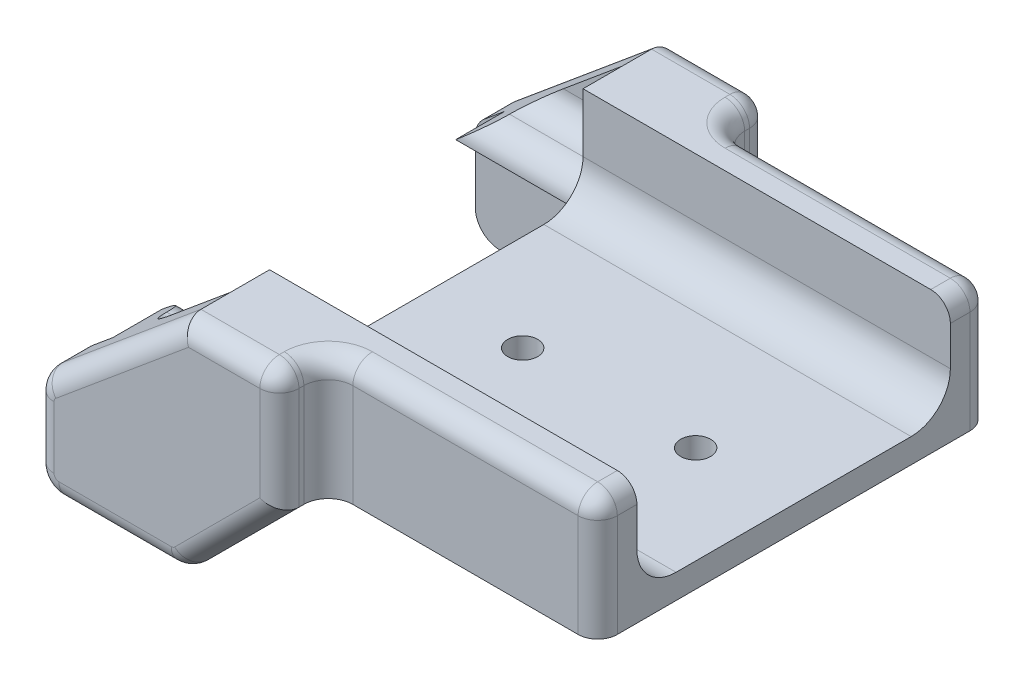
from build123d import *

# Parameters (mm, degrees)
SKETCH1_W           = 47.625
SKETCH1_H           = 50.8
BOSS_EXTRUDE1_DEPTH = 3.175
SKETCH2_R           = 1.9431
CUT_EXTRUDE1_DEPTH  = 35.961060929
SKETCH3_W           = 5.08
SKETCH3_H           = 12.7
BOSS_EXTRUDE2_DEPTH = 47.625
FILLET1_R           = 5.08
BOSS_EXTRUDE4_DEPTH = 6.35
FILLET4_R           = 3.175
BOSS_EXTRUDE5_DEPTH = 6.35
FILLET6_R           = 3.175
BOSS_EXTRUDE6_DEPTH = 6.35
FILLET8_R           = 3.175
FILLET9_R           = 3.175
FILLET10_R          = 2.54
FILLET11_R          = 2.54
FILLET12_R          = 2.54


with BuildPart() as part:
    # Sketch1 → Boss-Extrude1 (new body)
    with BuildSketch(Plane(origin=(0, 0, 0), x_dir=(1, 0, 0), z_dir=(0, 1, 0))):
        Rectangle(SKETCH1_W, SKETCH1_H)
    extrude(amount=BOSS_EXTRUDE1_DEPTH)

    # Sketch2 → Cut-Extrude1 (cut, through all)
    with BuildSketch(Plane(origin=(0, 3.175, 0), x_dir=(1, 0, 0), z_dir=(0, 1, 0))):
        with Locations(Location((11.1125, 0, 0), (0, 0, 270))):
            Circle(SKETCH2_R)
        with Locations(Location((-11.3157, 0, 0), (0, 0, 270))):
            Circle(SKETCH2_R)
    extrude(amount=-CUT_EXTRUDE1_DEPTH, mode=Mode.SUBTRACT)

    # Sketch3 → Boss-Extrude2 (add)
    with BuildSketch(Plane(origin=(23.8125, 0, 0), x_dir=(0, 0, -1), z_dir=(1, 0, 0))):
        with Locations((-22.86, 9.525)):
            Rectangle(SKETCH3_W, SKETCH3_H)
        with Locations((22.86, 9.525)):
            Rectangle(SKETCH3_W, SKETCH3_H)
    extrude(amount=-BOSS_EXTRUDE2_DEPTH)

    # Fillet1
    fillet1_edges = [part.edges().sort_by_distance(p)[0] for p in [
        (0, 3.175, 20.32),
        (0, 3.175, -20.32),
    ]]
    fillet(fillet1_edges, radius=FILLET1_R)

    # Sketch5 → Boss-Extrude4 (add)
    with BuildSketch(Plane(origin=(0, 0, -25.4), x_dir=(-1, 0, 0), z_dir=(0, 0, -1))):
        Polygon((11.1125, 15.875), (23.8125, 15.875), (42.8625, 0), (42.8625, -12.7), (23.8125, -12.7), (11.1125, 0), align=None)
    extrude(amount=BOSS_EXTRUDE4_DEPTH)

    # Fillet4
    # the kernel refuses this fillet: 3.175 mm, written as the material it adds along each edge
    with BuildSketch(Plane(origin=(-11.1125, 0, -25.4), x_dir=(1, 0, 0), z_dir=(0, 1, 0))) as fillet4_piece_1:
        with BuildLine():
            CenterArc((FILLET4_R, FILLET4_R), FILLET4_R, 180, 90)
            Line((0, FILLET4_R), (0, 0))
            Line((0, 0), (FILLET4_R, 0))
        make_face()
    extrude(amount=15.875)
    # the kernel refuses this fillet: 3.175 mm, written as the material it takes off along each edge
    with BuildSketch(Plane(origin=(-23.8125, -12.7, -22.112179849), x_dir=(0.7071067811865468, 0.7071067811865482, 0), z_dir=(0, 0, -1))) as fillet4_2_piece_1:
        with BuildLine():
            CenterArc((FILLET4_R * 0.414213562373, -FILLET4_R), FILLET4_R, 90, 45)
            Line((-FILLET4_R * 0.292893218813, -FILLET4_R * 0.292893218813), (0, 0))
            Line((0, 0), (FILLET4_R * 0.414213562373, 0))
        make_face()
    extrude(amount=12.925640303, mode=Mode.SUBTRACT)
    with BuildSketch(Plane(origin=(-42.8625, -12.7, -17.4625), x_dir=(1, 0, 0), z_dir=(0, 0, -1))) as fillet4_2_piece_2:
        with BuildLine():
            CenterArc((FILLET4_R, -FILLET4_R), FILLET4_R, 90, 90)
            Line((0, -FILLET4_R), (0, 0))
            Line((0, 0), (FILLET4_R, 0))
        make_face()
    extrude(amount=22.225, mode=Mode.SUBTRACT)
    with BuildSketch(Plane(origin=(-42.8625, 0, -21.682273866), x_dir=(0.7682212795973764, 0.6401843996644792, 0), z_dir=(0, 0, -1))) as fillet4_2_piece_3:
        with BuildLine():
            CenterArc((FILLET4_R * 0.468374945984, FILLET4_R), FILLET4_R, 219.805571092, 50.194428908)
            Line((-FILLET4_R * 0.299846333613, FILLET4_R * 0.359815600336), (0, 0))
            Line((0, 0), (FILLET4_R * 0.468374945984, 0))
        make_face()
    extrude(amount=13.785452268, mode=Mode.SUBTRACT)

    # Sketch6 → Boss-Extrude5 (add)
    with BuildSketch(Plane.XY.offset(25.4)):
        Polygon((-11.1125, 15.875), (-23.8125, 15.875), (-42.8625, 0), (-42.8625, -12.7), (-23.8125, -12.7), (-11.1125, 0), align=None)
    extrude(amount=BOSS_EXTRUDE5_DEPTH)

    # Fillet6
    # the kernel refuses this fillet: 3.175 mm, written as the material it adds along each edge
    with BuildSketch(Plane(origin=(-11.1125, 0, 25.4), x_dir=(1, 0, 0), z_dir=(0, 1, 0))) as fillet6_piece_1:
        with BuildLine():
            CenterArc((FILLET6_R, -FILLET6_R), FILLET6_R, 90, 90)
            Line((0, -FILLET6_R), (0, 0))
            Line((0, 0), (FILLET6_R, 0))
        make_face()
    extrude(amount=15.875)
    # the kernel refuses this fillet: 3.175 mm, written as the material it takes off along each edge
    with BuildSketch(Plane(origin=(-42.8625, 0, 21.682273866), x_dir=(0, -1, 0), z_dir=(0, 0, 1))) as fillet6_2_piece_1:
        with BuildLine():
            CenterArc((FILLET6_R * 0.468374945984, FILLET6_R), FILLET6_R, 219.805571092, 50.194428908)
            Line((-FILLET6_R * 0.299846333613, FILLET6_R * 0.359815600336), (0, 0))
            Line((0, 0), (FILLET6_R * 0.468374945984, 0))
        make_face()
    extrude(amount=13.785452268, mode=Mode.SUBTRACT)
    with BuildSketch(Plane(origin=(-42.8625, -12.7, 17.4625), x_dir=(1, 0, 0), z_dir=(0, 0, 1))) as fillet6_2_piece_2:
        with BuildLine():
            CenterArc((FILLET6_R, FILLET6_R), FILLET6_R, 180, 90)
            Line((0, FILLET6_R), (0, 0))
            Line((0, 0), (FILLET6_R, 0))
        make_face()
    extrude(amount=22.225, mode=Mode.SUBTRACT)
    with BuildSketch(Plane(origin=(-23.8125, -12.7, 22.112179849), x_dir=(0.7071067811865468, 0.7071067811865482, 0), z_dir=(0, 0, 1))) as fillet6_2_piece_3:
        with BuildLine():
            CenterArc((FILLET6_R * 0.414213562373, FILLET6_R), FILLET6_R, 225, 45)
            Line((-FILLET6_R * 0.292893218813, FILLET6_R * 0.292893218813), (0, 0))
            Line((0, 0), (FILLET6_R * 0.414213562373, 0))
        make_face()
    extrude(amount=12.925640303, mode=Mode.SUBTRACT)

    # Sketch7 → Boss-Extrude6 (add)
    with BuildSketch(Plane.XY.offset(-25.4)):
        Polygon((-23.8125, 3.175), (-39.0525, 3.175), (-35.2425, 6.35), (-23.8125, 6.35), align=None)
    boss_extrude6 = extrude(amount=BOSS_EXTRUDE6_DEPTH)

    # Fillet8
    # the kernel refuses this fillet: 3.175 mm, written as the material it adds along each edge
    with BuildSketch(Plane(origin=(-43.18, 6.35, -25.4), x_dir=(0, 0, 1), z_dir=(1, 0, 0))) as fillet8_piece_1_section:
        with BuildLine():
            CenterArc((FILLET8_R, -FILLET8_R), FILLET8_R, 90, 90)
            Line((0, -FILLET8_R), (0, 0))
            Line((0, 0), (FILLET8_R, 0))
        make_face()
    fillet8_piece_1 = extrude(amount=27.305, mode=Mode.PRIVATE)
    fillet8_piece_1 = split(fillet8_piece_1, bisect_by=Plane(origin=(-31.306679487, 9.629850427, -24.649765277), z_dir=(0.6401843996644798, -0.768221279597376, 0)), keep=Keep.TOP, mode=Mode.PRIVATE)
    add(fillet8_piece_1)
    # the kernel refuses this fillet: 3.175 mm, written as the material it takes off along each edge
    with BuildSketch(Plane(origin=(-43.18, 6.35, -19.05), x_dir=(0, -1, 0), z_dir=(1, 0, 0))) as fillet8_2_piece_1:
        with BuildLine():
            CenterArc((FILLET8_R, FILLET8_R), FILLET8_R, 180, 90)
            Line((0, FILLET8_R), (0, 0))
            Line((0, 0), (FILLET8_R, 0))
        make_face()
    extrude(amount=19.3675, mode=Mode.SUBTRACT)

    # Mirror5: Boss-Extrude6 across plane
    add(boss_extrude6.mirror(Plane.XY))

    # Fillet9
    # the kernel refuses this fillet: 3.175 mm, written as the material it adds along each edge
    with BuildSketch(Plane(origin=(-43.18, 6.35, 25.4), x_dir=(0, 0, -1), z_dir=(1, 0, 0))) as fillet9_piece_1_section:
        with BuildLine():
            CenterArc((FILLET9_R, FILLET9_R), FILLET9_R, 180, 90)
            Line((0, FILLET9_R), (0, 0))
            Line((0, 0), (FILLET9_R, 0))
        make_face()
    fillet9_piece_1 = extrude(amount=27.305, mode=Mode.PRIVATE)
    fillet9_piece_1 = split(fillet9_piece_1, bisect_by=Plane(origin=(-31.306679487, 9.629850427, 24.649765277), z_dir=(0.6401843996644802, -0.7682212795973757, 0)), keep=Keep.TOP, mode=Mode.PRIVATE)
    add(fillet9_piece_1)
    # the kernel refuses this fillet: 3.175 mm, written as the material it takes off along each edge
    with BuildSketch(Plane(origin=(-43.18, 6.35, 19.05), x_dir=(0, -1, 0), z_dir=(1, 0, 0))) as fillet9_2_piece_1:
        with BuildLine():
            CenterArc((FILLET9_R, -FILLET9_R), FILLET9_R, 90, 90)
            Line((0, -FILLET9_R), (0, 0))
            Line((0, 0), (FILLET9_R, 0))
        make_face()
    extrude(amount=19.3675, mode=Mode.SUBTRACT)

    # Fillet10
    fillet10_edges = [part.edges().sort_by_distance(p)[0] for p in [
        (-11.1125, 7.9375, 31.75),
        (-17.4625, 15.875, 31.75),
        (-32.766292734, 8.413506055, 31.75),
        (-16.997532015, -5.885032015, 31.75),
        (-32.40756403, -12.7, 31.75),
        (-42.8625, -5.506045227, 31.75),
        (-42.562746412, -0.14039707, 31.75),
        (-41.93256403, -11.77006403, 31.75),
        (-23.912608163, -12.458317516, 31.75),
        (-11.1125, 7.9375, -31.75),
        (-16.997532015, -5.885032015, -31.75),
        (-17.4625, 15.875, -31.75),
        (-32.40756403, -12.7, -31.75),
        (-42.8625, -5.506045227, -31.75),
        (-32.766292734, 8.413506055, -31.75),
        (-42.562746412, -0.14039707, -31.75),
        (-41.93256403, -11.77006403, -31.75),
        (-23.912608163, -12.458317516, -31.75),
    ]]
    fillet(fillet10_edges, radius=FILLET10_R)

    # Fillet11
    # the kernel refuses this fillet: 2.54 mm, written as the material it takes off along each edge
    with BuildSketch(Plane(origin=(-13.6525, 13.335, 29.21), x_dir=(1, 0, 0), z_dir=(0, 1, 0))) as fillet11_piece_1_section:
        Polygon((0, 0), (FILLET11_R, 0), (FILLET11_R, -FILLET11_R), (0, -FILLET11_R), align=None)
    fillet11_piece_1 = extrude(amount=FILLET11_R, mode=Mode.PRIVATE)
    fillet11_piece_1 = fillet11_piece_1 - Plane(origin=(-13.6525, 13.335, 29.21), x_dir=(-0.7071067811865475, 0, -0.7071067811865475), z_dir=(0, 1, 0)) * Sphere(FILLET11_R, mode=Mode.PRIVATE)
    add(fillet11_piece_1, mode=Mode.SUBTRACT)
    with BuildSketch(Plane(origin=(-13.6525, 13.335, -29.21), x_dir=(1, 0, 0), z_dir=(0, 1, 0))) as fillet11_piece_2_section:
        Polygon((0, 0), (FILLET11_R, 0), (FILLET11_R, FILLET11_R), (0, FILLET11_R), align=None)
    fillet11_piece_2 = extrude(amount=FILLET11_R, mode=Mode.PRIVATE)
    fillet11_piece_2 = fillet11_piece_2 - Plane(origin=(-13.6525, 13.335, -29.21), x_dir=(-0.7071067811865475, 0, 0.7071067811865475), z_dir=(0, 1, 0)) * Sphere(FILLET11_R, mode=Mode.PRIVATE)
    add(fillet11_piece_2, mode=Mode.SUBTRACT)
    with BuildSketch(Plane(origin=(30.1625, 15.875, 25.4), x_dir=(0, 0, -1), z_dir=(-1, 0, 0))) as fillet11_piece_3:
        with BuildLine():
            CenterArc((FILLET11_R, FILLET11_R), FILLET11_R, 180, 90)
            Line((0, FILLET11_R), (0, 0))
            Line((0, 0), (FILLET11_R, 0))
        make_face()
    extrude(amount=38.1, mode=Mode.SUBTRACT)
    with BuildSketch(Plane(origin=(-7.9375, 15.875, 28.575), x_dir=(0, 0, -1), z_dir=(1, 0, 0))) as fillet11_piece_4:
        with BuildLine():
            CenterArc((3.175 + FILLET11_R, -FILLET11_R), FILLET11_R, 90, 90)
            Line((3.175, -FILLET11_R), (3.175, 0))
            Line((3.175, 0), (3.175 + FILLET11_R, 0))
        make_face()
    revolve(axis=Axis((-7.9375, 15.875, 28.575), (0, 1, 0)), revolution_arc=90, mode=Mode.SUBTRACT)
    with BuildSketch(Plane(origin=(-11.1125, 15.875, 28.575), x_dir=(-1, 0, 0), z_dir=(0, 0, 1))) as fillet11_piece_5:
        with BuildLine():
            CenterArc((FILLET11_R, FILLET11_R), FILLET11_R, 180, 90)
            Line((0, FILLET11_R), (0, 0))
            Line((0, 0), (FILLET11_R, 0))
        make_face()
    extrude(amount=0.635, mode=Mode.SUBTRACT)
    with BuildSketch(Plane(origin=(-11.1125, 15.875, -28.575), x_dir=(-1, 0, 0), z_dir=(0, 0, -1))) as fillet11_piece_6:
        with BuildLine():
            CenterArc((FILLET11_R, -FILLET11_R), FILLET11_R, 90, 90)
            Line((0, -FILLET11_R), (0, 0))
            Line((0, 0), (FILLET11_R, 0))
        make_face()
    extrude(amount=0.635, mode=Mode.SUBTRACT)
    with BuildSketch(Plane(origin=(23.8125, -6.35, 25.4), x_dir=(-1, 0, 0), z_dir=(0, 1, 0)), Plane(origin=(23.8125, -6.35, -25.4), x_dir=(0, 0, 1), z_dir=(0, 1, 0))) as fillet11_piece_7:
        with BuildLine():
            CenterArc((FILLET11_R, -FILLET11_R), FILLET11_R, 90, 90)
            Line((0, -FILLET11_R), (0, 0))
            Line((0, 0), (FILLET11_R, 0))
        make_face()
    extrude(amount=28.575, mode=Mode.SUBTRACT)
    with BuildSketch(Plane(origin=(30.1625, 15.875, -25.4), x_dir=(0, 0, 1), z_dir=(-1, 0, 0))) as fillet11_piece_8:
        with BuildLine():
            CenterArc((FILLET11_R, -FILLET11_R), FILLET11_R, 90, 90)
            Line((0, -FILLET11_R), (0, 0))
            Line((0, 0), (FILLET11_R, 0))
        make_face()
    extrude(amount=38.1, mode=Mode.SUBTRACT)
    with BuildSketch(Plane(origin=(-7.9375, 15.875, -28.575), x_dir=(-1, 0, 0), z_dir=(0, 0, -1))) as fillet11_piece_9:
        with BuildLine():
            CenterArc((3.175 + FILLET11_R, -FILLET11_R), FILLET11_R, 90, 90)
            Line((3.175, -FILLET11_R), (3.175, 0))
            Line((3.175, 0), (3.175 + FILLET11_R, 0))
        make_face()
    revolve(axis=Axis((-7.9375, 15.875, -28.575), (0, 1, 0)), revolution_arc=90, mode=Mode.SUBTRACT)

    # Fillet12
    # the kernel refuses this fillet: 2.54 mm, written as the material it takes off along each edge
    with BuildSketch(Plane(origin=(21.2725, 13.335, 22.86), x_dir=(1, 0, 0), z_dir=(0, 1, 0))) as fillet12_piece_1_section:
        Polygon((0, 0), (FILLET12_R, 0), (FILLET12_R, -FILLET12_R), (0, -FILLET12_R), align=None)
    fillet12_piece_1 = extrude(amount=FILLET12_R, mode=Mode.PRIVATE)
    fillet12_piece_1 = fillet12_piece_1 - Plane(origin=(21.2725, 13.335, 22.86), x_dir=(-0.7071067811865475, 0, -0.7071067811865475), z_dir=(0, 1, 0)) * Sphere(FILLET12_R, mode=Mode.PRIVATE)
    add(fillet12_piece_1, mode=Mode.SUBTRACT)
    with BuildSketch(Plane(origin=(21.2725, 13.335, -22.86), x_dir=(0, 1, 0), z_dir=(1, 0, 0))) as fillet12_piece_2_section:
        Polygon((0, 0), (FILLET12_R, 0), (FILLET12_R, -FILLET12_R), (0, -FILLET12_R), align=None)
    fillet12_piece_2 = extrude(amount=FILLET12_R, mode=Mode.PRIVATE)
    fillet12_piece_2 = fillet12_piece_2 - Plane(origin=(21.2725, 13.335, -22.86), x_dir=(0, -0.7071067811865475, 0.7071067811865475), z_dir=(1, 0, 0)) * Sphere(FILLET12_R, mode=Mode.PRIVATE)
    add(fillet12_piece_2, mode=Mode.SUBTRACT)
    with BuildSketch(Plane(origin=(23.8125, 15.875, 13.97), x_dir=(-1, 0, 0), z_dir=(0, 0, 1)), Plane(origin=(23.8125, 15.875, -13.97), x_dir=(0, -1, 0), z_dir=(0, 0, -1))) as fillet12_piece_3:
        with BuildLine():
            CenterArc((FILLET12_R, FILLET12_R), FILLET12_R, 180, 90)
            Line((0, FILLET12_R), (0, 0))
            Line((0, 0), (FILLET12_R, 0))
        make_face()
    extrude(amount=8.89, mode=Mode.SUBTRACT)


solid = part.part
